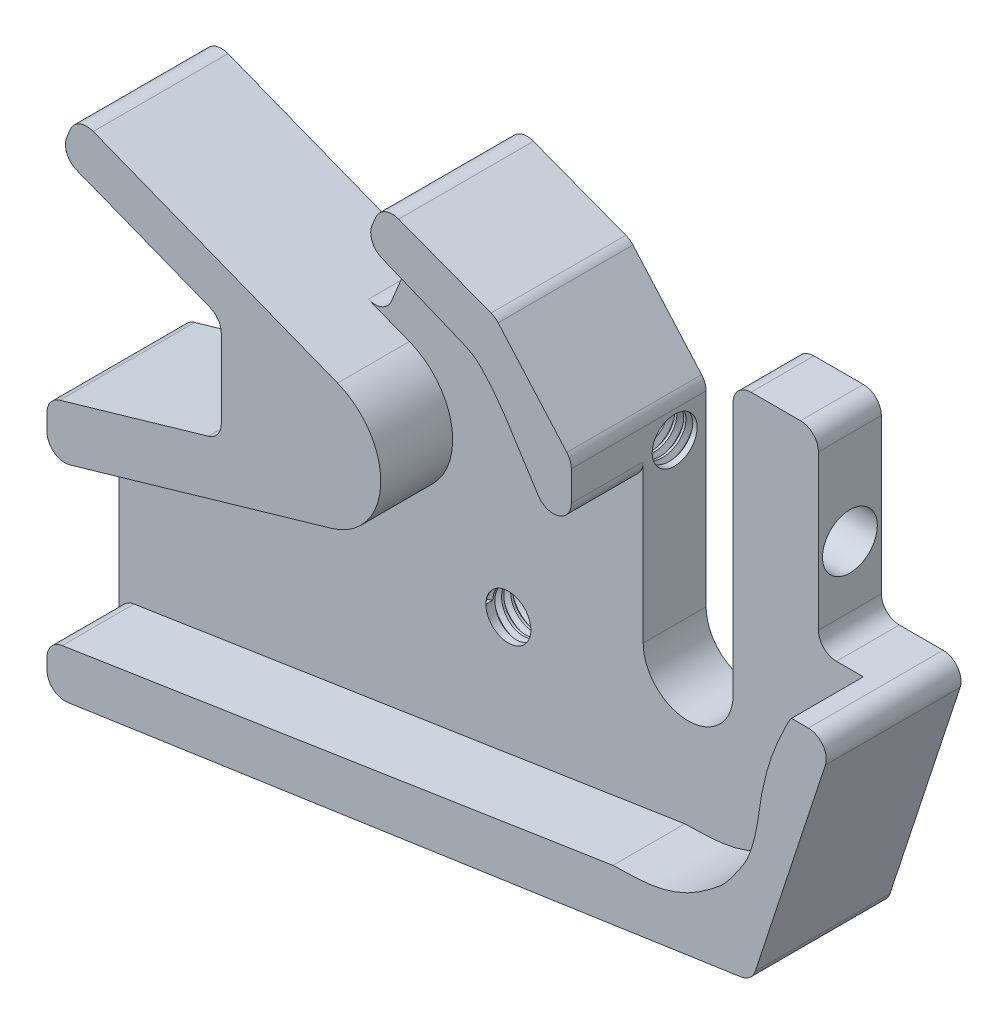
from build123d import *

# Parameters (mm, degrees)
BOSS_EXTRUDE1_DEPTH             = 7
SKETCH1_3_R                     = 7.578000113984699
BOSS_EXTRUDE2_DEPTH             = 15
FILLET1_R                       = 2
SKETCH4_R                       = 3.0499999999999976
CUT_EXTRUDE2_DEPTH              = 30
TAP_DRILL_FOR_M6X1_0_TAP3_D     = 5
TAP_DRILL_FOR_M6X1_0_TAP3_DEPTH = 30
TAP_DRILL_FOR_M6X1_0_TAP3_TIP   = 1.5021515475689007
THREAD2_PITCH                   = 1
TAP_DRILL_FOR_M6X1_0_TAP4_D     = 5
TAP_DRILL_FOR_M6X1_0_TAP4_DEPTH = 30
TAP_DRILL_FOR_M6X1_0_TAP4_TIP   = 1.5021515475689007
THREAD3_PITCH                   = 1


with BuildPart() as part:
    # Sketch1 → Boss-Extrude1 (new body)
    with BuildSketch(Plane.XY):
        with BuildLine():
            Line((78.96827475522947, 42.187825253742076), (71.54074542683735, 53.865587102003296))
            add(Edge.make_bspline(
                [(68.39034092425891, 57.62049653795409), (68.60270993607134, 57.45022207716796), (69.77589066925944, 56.287697416771124), (70.76711290567225, 54.998035868514094), (71.54074542683735, 53.865587102003296)],
                knots=[0.2241904650750364, 0.2241904650750364, 0.2241904650750364, 0.2241904650750364, 0.35338295041403034, 1, 1, 1, 1], degree=3))
            add(Edge.make_bspline(
                [(67.16681294608784, 58.3330475317527), (67.53066578937492, 58.148158454940294), (67.96561960838264, 57.94613577996738), (68.34100319904479, 57.66005482607508), (68.39034092425891, 57.62049653795409)],
                knots=[0, 0, 0, 0, 0.19417637174294056, 0.2241904650750364, 0.2241904650750364, 0.2241904650750364, 0.2241904650750364], degree=3))
            Line((67.16681294608784, 58.3330475317527), (56.03811631838445, 62.90331689854259))
            Line((56.03811631838445, 62.90331689854259), (50.21233359803197, 48.7174203330503))
            Line((50.21233359803197, 48.7174203330503), (52.95464713088683, 47.643030748312306))
            ThreePointArc((52.95464713088681, 47.64303074831224), (57.760447877225054, 40.24223776631537), (52.30143900683574, 33.30922401118043))
            Line((52.30143900683574, 33.30922401118043), (20.622854324708115, 24.120186594388674))
            Line((20.622854324708115, 24.120186594388674), (20.622828818370685, 6.763885488207949))
            Line((20.622828818370685, 6.763885488207948), (83.59996436724236, 16.48818112450211))
            add(Edge.make_bspline(
                [(83.59996436724236, 16.48818112450211), (85.41724211796225, 16.537565687608705), (87.87798883539797, 16.519220276594822), (90.67264688620287, 17.420541267562704), (92.39490917260585, 18.1773136176808), (94.09982159977365, 19.337279052055145), (95.76190532503422, 20.584169739390223), (96.83810880088447, 21.89338889230848), (97.57220809763582, 23.02149502177644), (98.29934242109825, 24.012698516819906), (98.81681106265586, 25.180735972047117), (99.33817140844377, 26.794771595498393), (99.75451749602459, 28.73305878632813), (99.97921568228254, 30.878234414842105), (100.4111923024278, 32.873047259282934), (100.84338947335871, 34.69277091010846), (101.41680882762638, 36.20884519743651), (101.85716726469936, 37.44614432520835), (102.35793677798266, 38.41365313450265), (102.84179664317215, 39.50097890638671), (103.16637837477245, 40.203448866163676), (103.46354532841673, 40.58470837115218)],
                knots=[0, 0, 0, 0, 0.15766908997979498, 0.20674224405265795, 0.25167492824254234, 0.3189710266158956, 0.38362214404723743, 0.4294745129255402, 0.4637446577681143, 0.49949683094742814, 0.5348288918556722, 0.5729782677608485, 0.645345116673923, 0.7047838929196132, 0.7582902839822957, 0.8207765070245413, 0.8653425984930124, 0.8975938824124198, 0.9336027965132895, 0.9588533452814706, 1, 1, 1, 1], degree=3))
            Line((103.46354532841673, 40.58470837115218), (98.46827475522947, 40.584708371152175))
            Line((98.46827475522947, 40.584708371152175), (98.46827475522947, 61.76545821531719))
            Line((98.46827475522947, 61.76545821531719), (88.96827475522947, 61.76545821531718))
            Line((88.96827475522947, 61.76545821531718), (88.96827475522946, 31.5935556342533))
            ThreePointArc((88.96827475522946, 31.5935556342533), (83.96827475522947, 26.593555634253313), (78.96827475522949, 31.593555634253303))
            Line((78.96827475522947, 31.593555634253303), (78.96827475522947, 42.187825253742076))
        make_face()
    extrude(amount=BOSS_EXTRUDE1_DEPTH)

    # Sketch1<3> → Boss-Extrude2 (add)
    with BuildSketch(Plane.XY):
        with BuildLine():
            Line((52.95464713088683, 47.643030748312306), (50.21233359803197, 48.7174203330503))
            Line((50.21233359803197, 48.7174203330503), (23.91329061275728, 59.02091682731907))
            Line((23.91329061275728, 59.02091682731907), (22.08936487086497, 54.365458215317176))
            Line((22.08936487086497, 54.365458215317176), (40.01978708427513, 47.34063824296787))
            Line((40.01978708427513, 47.34063824296787), (44.49575262392416, 45.58703468895018))
            ThreePointArc((44.49575262392417, 45.58703468895018), (48.4005247200828, 47.95082949329833), (52.95464713088681, 47.64303074831224))
        make_face()
        with Locations((50.19030425910602, 40.58721795212874)):
            Circle(SKETCH1_3_R)
        with BuildLine():
            ThreePointArc((43.63005434703988, 36.79390715299979), (42.648765078906784, 41.32969523869845), (44.49575262392417, 45.58703468895018))
            Line((44.49575262392416, 45.58703468895018), (40.01978708427513, 47.34063824296787))
            Line((40.01978708427513, 47.34063824296787), (40.019787084275116, 35.746673468318164))
            Line((40.01978708427511, 35.74667346831816), (43.63005434703988, 36.79390715299979))
        make_face()
        with BuildLine():
            Line((20.622854324708115, 24.120186594388674), (52.30143900683574, 33.30922401118043))
            ThreePointArc((52.30143900683574, 33.30922401118043), (47.364634323302816, 33.55574050130448), (43.63005434703988, 36.79390715299979))
            Line((43.63005434703988, 36.79390715299979), (40.01978708427511, 35.74667346831816))
            Line((40.01978708427511, 35.74667346831816), (20.622854324708136, 30.12018659438867))
            Line((20.622854324708136, 30.12018659438867), (20.622854324708115, 24.120186594388674))
        make_face()
        with BuildLine():
            Line((108.09825459829777, 40.58470837115217), (103.5353457354515, 40.58470837115218))
            Line((103.5353457354515, 40.58470837115218), (103.46354532841673, 40.58470837115218))
            add(Edge.make_bspline(
                [(83.59996436724236, 16.48818112450211), (85.41724211796225, 16.537565687608705), (87.87798883539797, 16.519220276594822), (90.67264688620287, 17.420541267562704), (92.39490917260585, 18.1773136176808), (94.09982159977365, 19.337279052055145), (95.76190532503422, 20.584169739390223), (96.83810880088447, 21.89338889230848), (97.57220809763582, 23.02149502177644), (98.29934242109825, 24.012698516819906), (98.81681106265586, 25.180735972047117), (99.33817140844377, 26.794771595498393), (99.75451749602459, 28.73305878632813), (99.97921568228254, 30.878234414842105), (100.4111923024278, 32.873047259282934), (100.84338947335871, 34.69277091010846), (101.41680882762638, 36.20884519743651), (101.85716726469936, 37.44614432520835), (102.35793677798266, 38.41365313450265), (102.84179664317215, 39.50097890638671), (103.16637837477245, 40.203448866163676), (103.46354532841673, 40.58470837115218)],
                knots=[0, 0, 0, 0, 0.15766908997979498, 0.20674224405265795, 0.25167492824254234, 0.3189710266158956, 0.38362214404723743, 0.4294745129255402, 0.4637446577681143, 0.49949683094742814, 0.5348288918556722, 0.5729782677608485, 0.645345116673923, 0.7047838929196132, 0.7582902839822957, 0.8207765070245413, 0.8653425984930124, 0.8975938824124198, 0.9336027965132895, 0.9588533452814706, 1, 1, 1, 1], degree=3))
            Line((83.59996436724236, 16.48818112450211), (20.622828818370685, 6.763885488207948))
            Line((20.622828818370685, 6.76388548820795), (20.62282837749903, 6.463885488208274))
            Line((20.62282837749903, 6.463885488208274), (20.62282110130341, 1.512651604953091))
            Line((20.6228211013034, 1.512651604953092), (99.05570161577305, 13.035195870356917))
            Line((99.05570161577305, 13.035195870356915), (108.09825459829777, 40.58470837115217))
        make_face()
        with BuildLine():
            Line((78.96827475522947, 42.187825253742076), (78.96827475522947, 43.59355563425329))
            Line((78.96827475522947, 43.59355563425329), (78.96827475522947, 49.285790380927594))
            Line((78.96827475522947, 49.285790380927594), (78.96827475522947, 52.81430633566804))
            Line((78.96827475522947, 52.81430633566804), (78.96827475522947, 53.14598079095306))
            Line((78.96827475522947, 53.14598079095306), (77.37761026058446, 54.95096484877639))
            Line((77.37761026058446, 54.95096484877639), (70.50082285395956, 62.75430218344684))
            Line((70.50082285395956, 62.75430218344684), (68.3903409242587, 57.62049653795413))
            add(Edge.make_bspline(
                [(68.39034092425891, 57.62049653795409), (68.60270993607134, 57.45022207716796), (69.77589066925944, 56.287697416771124), (70.76711290567225, 54.998035868514094), (71.54074542683735, 53.865587102003296)],
                knots=[0.2241904650750364, 0.2241904650750364, 0.2241904650750364, 0.2241904650750364, 0.35338295041403034, 1, 1, 1, 1], degree=3))
            Line((71.54074542683735, 53.865587102003296), (77.94135898527813, 43.80236991179886))
            Line((77.94135898527813, 43.80236991179886), (78.96827475522947, 42.187825253742076))
        make_face()
        with BuildLine():
            add(Edge.make_bspline(
                [(67.16681294608784, 58.3330475317527), (67.53066578937492, 58.148158454940294), (67.96561960838264, 57.94613577996738), (68.34100319904479, 57.66005482607508), (68.39034092425891, 57.62049653795409)],
                knots=[0, 0, 0, 0, 0.19417637174294056, 0.2241904650750364, 0.2241904650750364, 0.2241904650750364, 0.2241904650750364], degree=3))
            Line((68.3903409242587, 57.62049653795413), (70.50082285395956, 62.75430218344684))
            Line((70.50082285395956, 62.75430218344684), (57.93755222306168, 67.52848103011922))
            Line((57.93755222306168, 67.52848103011922), (56.03811631838445, 62.90331689854259))
            Line((56.03811631838445, 62.90331689854259), (67.16681294608784, 58.3330475317527))
        make_face()
    extrude(amount=BOSS_EXTRUDE2_DEPTH)

    # Fillet1
    fillet1_edges = [part.edges().sort_by_distance(p)[0] for p in [
        (78.96827475522947, 53.14598079095306, 7.5),
        (70.50082285395956, 62.75430218344684, 7.5),
        (99.05570161577305, 13.035195870356915, 7.5),
        (108.09825459829777, 40.58470837115217, 7.5),
        (98.46827475522947, 61.76545821531719, 3.5),
        (88.96827475522947, 61.76545821531718, 3.5),
        (57.93755222306168, 67.52848103011922, 7.5),
        (56.03811631838445, 62.90331689854259, 11),
        (78.96827475522947, 42.187825253742076, 11),
        (20.622854324708115, 24.120186594388674, 11),
        (20.622854324708136, 30.12018659438867, 7.5),
        (23.91329061275728, 59.02091682731907, 7.5),
        (22.08936487086497, 54.365458215317176, 7.5),
        (40.01978708427513, 47.34063824296787, 7.5),
        (40.01978708427511, 35.746673468318164, 7.5),
        (20.622821101303405, 1.5126516049530916, 7.5),
        (50.21233359803197, 48.7174203330503, 3.5),
        (98.46827475522947, 40.584708371152175, 3.5),
        (20.622828818370685, 6.763885488207949, 11),
    ]]
    fillet(fillet1_edges, radius=FILLET1_R)

    # Sketch4 → Cut-Extrude2 (cut)
    with BuildSketch(Plane.ZY.offset(-88.96827475522943)):
        with Locations((3.5, 49.393555634253374)):
            Circle(SKETCH4_R)
    extrude(amount=-CUT_EXTRUDE2_DEPTH, mode=Mode.SUBTRACT)

    # Tap Drill for M6x1.0 Tap3
    with Locations(Plane(origin=(88.968274755, 49.393555634, 3.5), x_dir=(0, 1, 0), z_dir=(1, 0, 0))):
        with Locations((0, 0)):
            Hole(TAP_DRILL_FOR_M6X1_0_TAP3_D / 2, depth=TAP_DRILL_FOR_M6X1_0_TAP3_DEPTH)
            with Locations((0, 0, -(TAP_DRILL_FOR_M6X1_0_TAP3_DEPTH + TAP_DRILL_FOR_M6X1_0_TAP3_TIP / 2))):  # 118° drill point
                Cone(0, TAP_DRILL_FOR_M6X1_0_TAP3_D / 2, TAP_DRILL_FOR_M6X1_0_TAP3_TIP, mode=Mode.SUBTRACT)

    # Thread2: the profile of Thread Profile2 profile screwed along a right-hand helix of 20 turns, 8 arcs to a turn; built about Z, then put on its axis
    thread2_z = Axis((0, 0, 0), (0, 0, 1))
    thread2_corners = [(2.4997, 0, -0.000173205), (3.041265875, 0, 0.312499998), (3.041265875, 0, 0.437499998), (2.4997, 0, 0.750173202)]
    with BuildLine(mode=Mode.PRIVATE) as thread2_profile:
        Line(thread2_corners[0], thread2_corners[1])
        Line(thread2_corners[1], thread2_corners[2])
        Line(thread2_corners[2], thread2_corners[3])
        Line(thread2_corners[3], thread2_corners[0])
    thread2_cap = Face(thread2_profile.wire())
    thread2_turn_angles = [0, 22.5, 45, 67.5, 90, 112.5, 135, 157.5, 180, 202.5, 225, 247.5, 270, 292.5, 315, 337.5, 360]
    thread2_turn_weights = [1, 0.9238795325112867, 1, 0.9238795325112867, 1, 0.9238795325112867, 1, 0.9238795325112867, 1, 0.9238795325112867, 1, 0.9238795325112867, 1, 0.9238795325112867, 1, 0.9238795325112867, 1]
    thread2_turn_rails = [Edge.make_bspline([Vector(p[0], p[1], 0).rotate(thread2_z, thread2_turn_angles[k]) / thread2_turn_weights[k] + Vector(0, 0, p[2] + THREAD2_PITCH * thread2_turn_angles[k] / 360) for k in range(17)], [0, 0, 0, 1, 1, 2, 2, 3, 3, 4, 4, 5, 5, 6, 6, 7, 7, 8, 8, 8], 2, thread2_turn_weights) for p in thread2_corners]
    thread2_turn_sides = [Face.make_surface_from_curves(thread2_turn_rails[p[0]], thread2_turn_rails[p[1]]) for p in [(0, 1), (1, 2), (2, 3), (3, 0)]]
    thread2 = Plane(origin=(78.968274755, 49.393555634, 3.5), x_dir=(0, 0, 1), z_dir=(-1, 0, 0)) * Solid(Shell([*[p.moved(Location((0, 0, THREAD2_PITCH * i))) for i in range(20) for p in thread2_turn_sides], thread2_cap, thread2_cap.rotate(thread2_z, 7200).moved(Location((0, 0, THREAD2_PITCH * 7200 / 360)))]))
    add(thread2, mode=Mode.SUBTRACT)

    # Tap Drill for M6x1.0 Tap4
    with Locations(Plane(origin=(63.968274755, 26.593555634, 7), x_dir=(1, 0, 0), z_dir=(0, 0, 1))):
        with Locations((0, 0)):
            Hole(TAP_DRILL_FOR_M6X1_0_TAP4_D / 2, depth=TAP_DRILL_FOR_M6X1_0_TAP4_DEPTH)
            with Locations((0, 0, -(TAP_DRILL_FOR_M6X1_0_TAP4_DEPTH + TAP_DRILL_FOR_M6X1_0_TAP4_TIP / 2))):  # 118° drill point
                Cone(0, TAP_DRILL_FOR_M6X1_0_TAP4_D / 2, TAP_DRILL_FOR_M6X1_0_TAP4_TIP, mode=Mode.SUBTRACT)

    # Thread3: the profile of Thread Profile3 profile screwed along a right-hand helix of 20 turns, 8 arcs to a turn; built about Z, then put on its axis
    thread3_z = Axis((0, 0, 0), (0, 0, 1))
    thread3_corners = [(2.4997, 0, -0.000173205), (3.041265875, 0, 0.312499999), (3.041265875, 0, 0.437499999), (2.4997, 0, 0.750173202)]
    with BuildLine(mode=Mode.PRIVATE) as thread3_profile:
        Line(thread3_corners[0], thread3_corners[1])
        Line(thread3_corners[1], thread3_corners[2])
        Line(thread3_corners[2], thread3_corners[3])
        Line(thread3_corners[3], thread3_corners[0])
    thread3_cap = Face(thread3_profile.wire())
    thread3_turn_angles = [0, 22.5, 45, 67.5, 90, 112.5, 135, 157.5, 180, 202.5, 225, 247.5, 270, 292.5, 315, 337.5, 360]
    thread3_turn_weights = [1, 0.9238795325112867, 1, 0.9238795325112867, 1, 0.9238795325112867, 1, 0.9238795325112867, 1, 0.9238795325112867, 1, 0.9238795325112867, 1, 0.9238795325112867, 1, 0.9238795325112867, 1]
    thread3_turn_rails = [Edge.make_bspline([Vector(p[0], p[1], 0).rotate(thread3_z, thread3_turn_angles[k]) / thread3_turn_weights[k] + Vector(0, 0, p[2] + THREAD3_PITCH * thread3_turn_angles[k] / 360) for k in range(17)], [0, 0, 0, 1, 1, 2, 2, 3, 3, 4, 4, 5, 5, 6, 6, 7, 7, 8, 8, 8], 2, thread3_turn_weights) for p in thread3_corners]
    thread3_turn_sides = [Face.make_surface_from_curves(thread3_turn_rails[p[0]], thread3_turn_rails[p[1]]) for p in [(0, 1), (1, 2), (2, 3), (3, 0)]]
    thread3 = Plane(origin=(63.968274755, 26.593555634, 7), x_dir=(-1, 0, 0), z_dir=(0, 0, -1)) * Solid(Shell([*[p.moved(Location((0, 0, THREAD3_PITCH * i))) for i in range(20) for p in thread3_turn_sides], thread3_cap, thread3_cap.rotate(thread3_z, 7200).moved(Location((0, 0, THREAD3_PITCH * 7200 / 360)))]))
    add(thread3, mode=Mode.SUBTRACT)


solid = part.part
